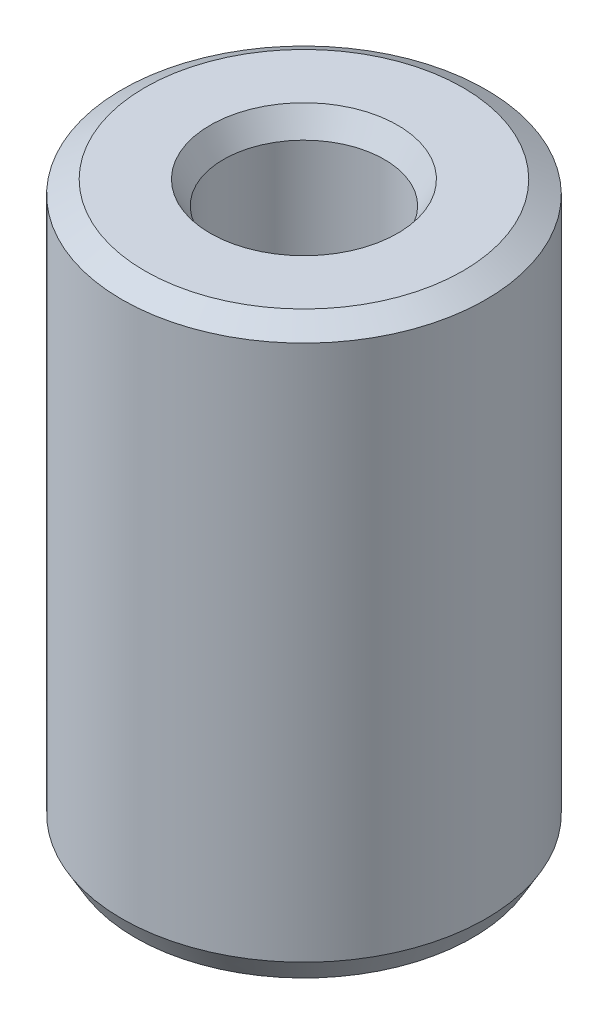
from build123d import *
from OCP.BRepFilletAPI import BRepFilletAPI_MakeChamfer

# Parameters (mm, degrees)
SKETCH1_R           = 47.5
BOSS_EXTRUDE1_DEPTH = 149.43358822
SKETCH2_R           = 20.99394226
CUT_EXTRUDE1_DEPTH  = 164.838021498
CHAMFER1_SIZE       = 3.468123097
CHAMFER1_SIZE2      = 6.006965411


with BuildPart() as part:
    # Sketch1 → Boss-Extrude1 (new body)
    with BuildSketch(Plane(origin=(0, 0, 0), x_dir=(1, 0, 0), z_dir=(0, 1, 0))):
        Circle(SKETCH1_R)
    extrude(amount=BOSS_EXTRUDE1_DEPTH)

    # Sketch2 → Cut-Extrude1 (cut, through all)
    with BuildSketch(Plane(origin=(0, 0, 0), x_dir=(1, 0, 0), z_dir=(0, 1, 0))):
        Circle(SKETCH2_R)
    extrude(amount=CUT_EXTRUDE1_DEPTH, mode=Mode.SUBTRACT)

    # Chamfer1: one chamfer whose edges measure the first distance from different faces: ONE call of the kernel's chamfer builder (chamfer() names one face for all edges)
    chamfer1_edges_1 = [part.edges().sort_by_distance(p)[0] for p in [
        (-20.99394226, 149.43358822, 0),
    ]]
    chamfer1_side_1 = [part.faces().sort_by_distance(p)[0] for p in [
        (-46.156497116, 149.43358822, 0),
    ]]
    chamfer1_edges_2 = [part.edges().sort_by_distance(p)[0] for p in [
        (-20.99394226, 0, 0),
    ]]
    chamfer1_side_2 = [part.faces().sort_by_distance(p)[0] for p in [
        (-20.99394226, 74.71679411, 0),
    ]]
    chamfer1_edges_3 = [part.edges().sort_by_distance(p)[0] for p in [
        (-47.5, 0, 0),
    ]]
    chamfer1_side_3 = [part.faces().sort_by_distance(p)[0] for p in [
        (-46.156497116, 0, 0),
    ]]
    chamfer1_edges_4 = [part.edges().sort_by_distance(p)[0] for p in [
        (-47.5, 149.43358822, 0),
    ]]
    chamfer1_side_4 = [part.faces().sort_by_distance(p)[0] for p in [
        (-47.5, 74.71679411, 0),
    ]]
    chamfer1 = BRepFilletAPI_MakeChamfer(part.part.solid().wrapped)
    for e in chamfer1_edges_1:
        chamfer1.Add(CHAMFER1_SIZE, CHAMFER1_SIZE2, e.wrapped, chamfer1_side_1[0].wrapped)  # the first distance lies on this face
    for e in chamfer1_edges_2:
        chamfer1.Add(CHAMFER1_SIZE, CHAMFER1_SIZE2, e.wrapped, chamfer1_side_2[0].wrapped)  # the first distance lies on this face
    for e in chamfer1_edges_3:
        chamfer1.Add(CHAMFER1_SIZE, CHAMFER1_SIZE2, e.wrapped, chamfer1_side_3[0].wrapped)  # the first distance lies on this face
    for e in chamfer1_edges_4:
        chamfer1.Add(CHAMFER1_SIZE, CHAMFER1_SIZE2, e.wrapped, chamfer1_side_4[0].wrapped)  # the first distance lies on this face
    add(Compound.cast(chamfer1.Shape()), mode=Mode.REPLACE)


solid = part.part
